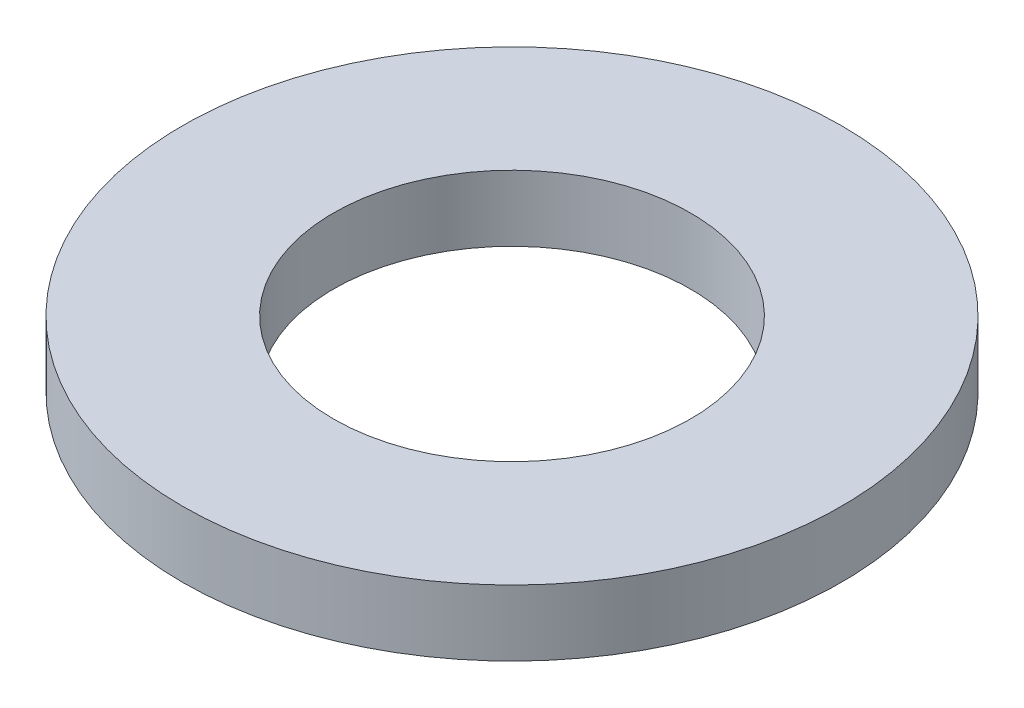
from build123d import *

# Parameters (mm, degrees)
SKETCH1_R           = 60
BOSS_EXTRUDE1_DEPTH = 12
SKETCH2_R           = 32.5
CUT_EXTRUDE1_DEPTH  = 86.697141143


with BuildPart() as part:
    # Sketch1 → Boss-Extrude1 (new body)
    with BuildSketch(Plane(origin=(0, 0, 0), x_dir=(1, 0, 0), z_dir=(0, 1, 0))):
        Circle(SKETCH1_R)
    extrude(amount=BOSS_EXTRUDE1_DEPTH)

    # Sketch2 → Cut-Extrude1 (cut, through all)
    with BuildSketch(Plane(origin=(0, 0, 0), x_dir=(1, 0, 0), z_dir=(0, 1, 0))):
        Circle(SKETCH2_R)
    extrude(amount=CUT_EXTRUDE1_DEPTH, mode=Mode.SUBTRACT)


solid = part.part
